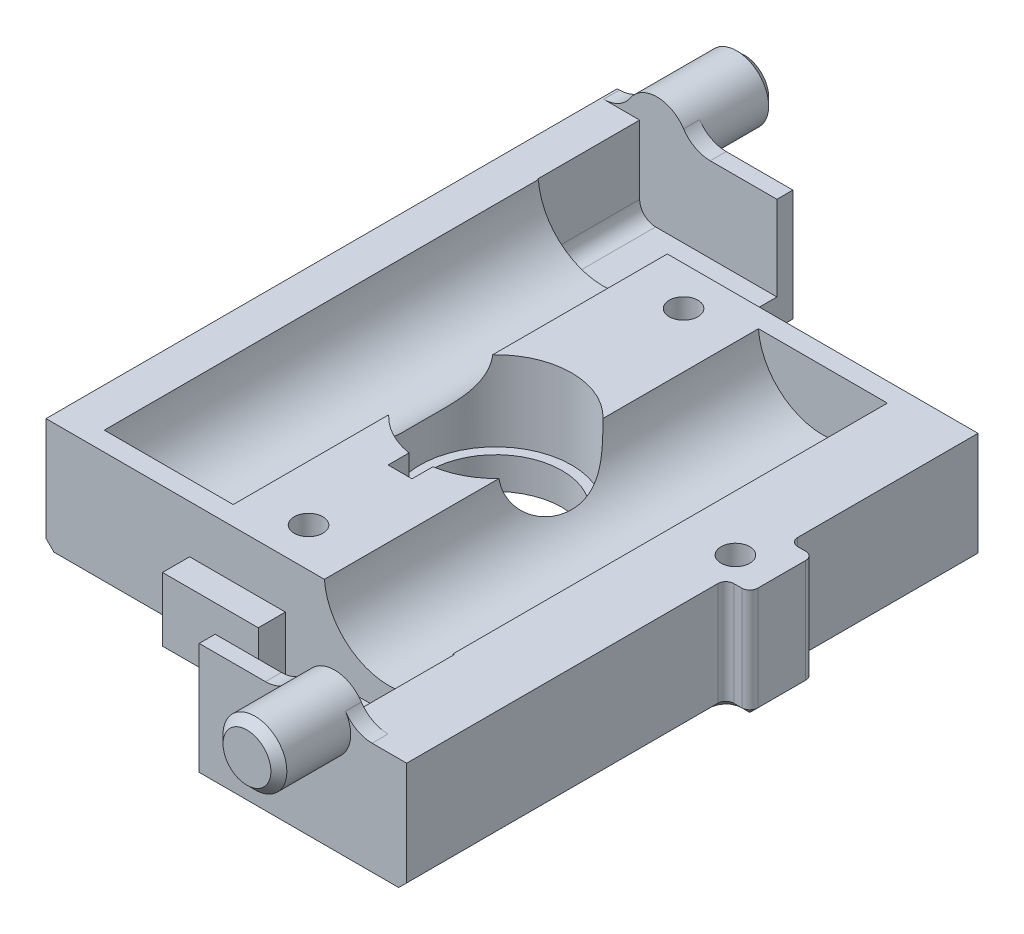
from build123d import *

# Parameters (mm, degrees)
SKETCH1_W            = 30
SKETCH1_H            = 30.8
BOSS_EXTRUDE1_DEPTH  = 7
SKETCH2_R            = 4.15
CUT_EXTRUDE1_DEPTH   = 6.5
SKETCH3_W            = 15
SKETCH3_H            = 1.2
SKETCH3_W_2          = 9
SKETCH3_W_3          = 11
SKETCH3_W_4          = 13
CUT_EXTRUDE2_DEPTH   = 4
SKETCH4_W            = 30
SKETCH4_H            = 3
CUT_EXTRUDE3_DEPTH   = 1.2
SKETCH5_W            = 30
SKETCH5_H            = 3
CUT_EXTRUDE4_DEPTH   = 1.2
SKETCH6_R            = 4.05
CUT_EXTRUDE5_DEPTH   = 27.2
SKETCH7_R            = 4.05
CUT_EXTRUDE6_DEPTH   = 27.2
SKETCH8_R            = 4.75
CUT_EXTRUDE7_DEPTH   = 5
BOSS_EXTRUDE2_DEPTH  = 6.4
FILLET1_R            = 1
BOSS_EXTRUDE3_DEPTH  = 6.4
FILLET2_R            = 1
SKETCH12_W           = 1.5
SKETCH12_H           = 1.344099237
CUT_EXTRUDE8_DEPTH   = 5
SKETCH13_W           = 13
SKETCH13_H           = 7
BOSS_EXTRUDE4_DEPTH  = 1
SKETCH14_W           = 11
SKETCH14_H           = 7
BOSS_EXTRUDE5_DEPTH  = 1
SKETCH15_R           = 2
BOSS_EXTRUDE8_DEPTH  = 5.5
SKETCH16_R           = 2
BOSS_EXTRUDE9_DEPTH  = 5.5
FILLET3_R            = 2
FILLET4_R            = 2
FILLET5_R            = 2
CHAMFER2_SIZE        = 0.5
CHAMFER3_SIZE        = 0.5
SKETCH17_W           = 4
SKETCH17_H           = 7
BOSS_EXTRUDE10_DEPTH = 1.5
FILLET7_R            = 0.5
SKETCH18_R           = 0.9
CUT_EXTRUDE9_DEPTH   = 99.965895754
SKETCH19_R           = 1.6
CUT_EXTRUDE10_DEPTH  = 2
SKETCH20_R           = 0.9
CUT_EXTRUDE11_DEPTH  = 99.965895754
SKETCH21_R           = 1.6
CUT_EXTRUDE12_DEPTH  = 2
CHAMFER6_SIZE        = 0.5
SKETCH22_W           = 6
SKETCH22_H           = 4
BOSS_EXTRUDE11_DEPTH = 0.5
SKETCH23_W           = 6
SKETCH23_H           = 4
BOSS_EXTRUDE12_DEPTH = 0.5


with BuildPart() as part:
    # Sketch1 → Boss-Extrude1 (new body)
    with BuildSketch(Plane(origin=(0, 0, 0), x_dir=(1, 0, 0), z_dir=(0, 1, 0))):
        with Locations((-46.45686042, -50.970505576)):
            Rectangle(SKETCH1_W, SKETCH1_H)
    extrude(amount=BOSS_EXTRUDE1_DEPTH)

    # Sketch2 → Cut-Extrude1 (cut)
    with BuildSketch(Plane.XZ):
        with Locations(Location((-47.47186042, 50.970505576, 0), (0, 0, 270))):
            Circle(SKETCH2_R)
    extrude(amount=-CUT_EXTRUDE1_DEPTH, mode=Mode.SUBTRACT)

    # Sketch3 → Cut-Extrude2 (cut)
    with BuildSketch(Plane.XZ):
        with Locations((-38.95686042, 65.770505576)):
            Rectangle(SKETCH3_W, SKETCH3_H)
        with Locations((-56.95686042, 65.770505576)):
            Rectangle(SKETCH3_W_2, SKETCH3_H)
        with Locations((-36.95686042, 36.170505576)):
            Rectangle(SKETCH3_W_3, SKETCH3_H)
        with Locations((-54.95686042, 36.170505576)):
            Rectangle(SKETCH3_W_4, SKETCH3_H)
    extrude(amount=-CUT_EXTRUDE2_DEPTH, mode=Mode.SUBTRACT)

    # Sketch4 → Cut-Extrude3 (cut)
    with BuildSketch(Plane.XY.offset(66.370505576)):
        with Locations((-46.45686042, 5.5)):
            Rectangle(SKETCH4_W, SKETCH4_H)
    extrude(amount=-CUT_EXTRUDE3_DEPTH, mode=Mode.SUBTRACT)

    # Sketch5 → Cut-Extrude4 (cut)
    with BuildSketch(Plane(origin=(0, 0, 35.570505576), x_dir=(-1, 0, 0), z_dir=(0, 0, -1))):
        with Locations((46.45686042, 5.5)):
            Rectangle(SKETCH5_W, SKETCH5_H)
    extrude(amount=-CUT_EXTRUDE4_DEPTH, mode=Mode.SUBTRACT)

    # Sketch6 → Cut-Extrude5 (cut)
    with BuildSketch(Plane.XY.offset(65.170505576)):
        with Locations((-39.974556342, 7.3)):
            Circle(SKETCH6_R)
    extrude(amount=-CUT_EXTRUDE5_DEPTH, mode=Mode.SUBTRACT)

    # Sketch7 → Cut-Extrude6 (cut)
    with BuildSketch(Plane(origin=(0, 0, 36.770505576), x_dir=(-1, 0, 0), z_dir=(0, 0, -1))):
        with Locations((54.96455223, 7.3)):
            Circle(SKETCH7_R)
    extrude(amount=-CUT_EXTRUDE6_DEPTH, mode=Mode.SUBTRACT)

    # Sketch8 → Cut-Extrude7 (cut)
    with BuildSketch(Plane(origin=(0, 7, 0), x_dir=(1, 0, 0), z_dir=(0, 1, 0))):
        with Locations(Location((-47.47186042, -50.970505576, 0), (0, 0, 270))):
            Circle(SKETCH8_R)
    extrude(amount=-CUT_EXTRUDE7_DEPTH, mode=Mode.SUBTRACT)

    # Sketch10 → Boss-Extrude2 (add)
    with BuildSketch(Plane.XY.offset(65.170505576)):
        Polygon((-31.45686042, 0), (-31.45686042, 7), (-35.85686042, 7), (-35.85686042, 1.7), (-44.45686042, 1.7), (-44.45686042, 0), align=None)
    extrude(amount=BOSS_EXTRUDE2_DEPTH)

    # Fillet1
    fillet1_edges = [part.edges().sort_by_distance(p)[0] for p in [
        (-35.85686042, 1.7, 68.370505576),
    ]]
    fillet(fillet1_edges, radius=FILLET1_R)

    # Sketch11 → Boss-Extrude3 (add)
    with BuildSketch(Plane(origin=(0, 0, 36.770505576), x_dir=(-1, 0, 0), z_dir=(0, 0, -1))):
        Polygon((61.45686042, 7), (61.45686042, 0), (50.45686042, 0), (50.45686042, 1.7), (59.05686042, 1.7), (59.05686042, 7), align=None)
    extrude(amount=BOSS_EXTRUDE3_DEPTH)

    # Fillet2
    fillet2_edges = [part.edges().sort_by_distance(p)[0] for p in [
        (-59.05686042, 1.7, 33.570505576),
    ]]
    fillet(fillet2_edges, radius=FILLET2_R)

    # Sketch12 → Cut-Extrude8 (cut)
    with BuildSketch(Plane(origin=(0, 7, 0), x_dir=(1, 0, 0), z_dir=(0, 1, 0))):
        with Locations((-47.47186042, -56.298455958)):
            Rectangle(SKETCH12_W, SKETCH12_H)
    extrude(amount=-CUT_EXTRUDE8_DEPTH, mode=Mode.SUBTRACT)

    # Sketch13 → Boss-Extrude4 (add)
    with BuildSketch(Plane.XY.offset(71.570505576)):
        with Locations((-37.95686042, 3.5)):
            Rectangle(SKETCH13_W, SKETCH13_H)
    extrude(amount=BOSS_EXTRUDE4_DEPTH)

    # Sketch14 → Boss-Extrude5 (add)
    with BuildSketch(Plane(origin=(0, 0, 30.370505576), x_dir=(-1, 0, 0), z_dir=(0, 0, -1))):
        with Locations((55.95686042, 3.5)):
            Rectangle(SKETCH14_W, SKETCH14_H)
    extrude(amount=BOSS_EXTRUDE5_DEPTH)

    # Sketch15 → Boss-Extrude8 (add)
    with BuildSketch(Plane.XY.offset(71.570505576)):
        with Locations(Location((-36.96455223, 6.8, 0), (0, 0, 174.260829523))):
            Circle(SKETCH15_R)
    extrude(amount=BOSS_EXTRUDE8_DEPTH)

    # Sketch16 → Boss-Extrude9 (add)
    with BuildSketch(Plane(origin=(0, 0, 30.370505576), x_dir=(-1, 0, 0), z_dir=(0, 0, -1))):
        with Locations(Location((57.974556342, 6.8, 0), (0, 0, 174.260829523))):
            Circle(SKETCH16_R)
    extrude(amount=BOSS_EXTRUDE9_DEPTH)

    # Fillet3
    fillet3_edges = [part.edges().sort_by_distance(p)[0] for p in [
        (-59.964531217, 7, 29.870505576),
    ]]
    fillet(fillet3_edges, radius=FILLET3_R)

    # Fillet4
    # the kernel refuses this fillet: 2 mm, written as the material it adds along each edge
    with BuildSketch(Plane(origin=(-55.984581468, 7, 30.370505576), x_dir=(1.0, 6.770411692114482e-12, 0), z_dir=(0, 0, -1))) as fillet4_piece_1:
        with BuildLine():
            CenterArc((1.350683743, -2), FILLET4_R, 90, 56.632987031)
            ThreePointArc((-0.319645565, -0.9), (-0.105311329, -0.469360383), (0, 0))
            Line((0, 0), (1.350683743, 0))
        make_face()
    extrude(amount=1)

    # Fillet5
    # the kernel refuses this fillet: 2 mm, written as the material it adds along each edge
    with BuildSketch(Plane(origin=(-38.954527104, 7, 71.570505576), x_dir=(-1.0, 6.9854393361833605e-12, 0), z_dir=(0, 0, 1)), Plane(origin=(-34.974577356, 7, 72.570505576), x_dir=(1, 0, 0), z_dir=(0, 0, -1))) as fillet5_piece_1:
        with BuildLine():
            CenterArc((1.350683743, -2), FILLET5_R, 90, 56.632987031)
            ThreePointArc((-0.319645565, -0.9), (-0.105311329, -0.469360383), (0, 0))
            Line((0, 0), (1.350683743, 0))
        make_face()
    extrude(amount=1)

    # Chamfer2
    chamfer2_edges = [part.edges().sort_by_distance(p)[0] for p in [
        (-34.974577356, 6.6, 77.070505576),
    ]]
    chamfer(chamfer2_edges, length=CHAMFER2_SIZE)

    # Chamfer3
    chamfer3_edges = [part.edges().sort_by_distance(p)[0] for p in [
        (-59.964531217, 6.6, 24.870505576),
    ]]
    chamfer(chamfer3_edges, length=CHAMFER3_SIZE)

    # Sketch17 → Boss-Extrude10 (add)
    with BuildSketch(Plane(origin=(-31.45686042, 0, 0), x_dir=(0, 0, -1), z_dir=(1, 0, 0))):
        with Locations((-50.570505576, 3.5)):
            Rectangle(SKETCH17_W, SKETCH17_H)
    extrude(amount=BOSS_EXTRUDE10_DEPTH)

    # Fillet7
    fillet7_edges = [part.edges().sort_by_distance(p)[0] for p in [
        (-31.45686042, 3.5, 52.570505576),
        (-31.45686042, 3.5, 48.570505576),
        (-29.95686042, 3.5, 52.570505576),
        (-29.95686042, 3.5, 48.570505576),
    ]]
    fillet(fillet7_edges, radius=FILLET7_R)

    # Sketch18 → Cut-Extrude9 (cut, through all)
    with BuildSketch(Plane.XZ):
        with Locations(Location((-32.45686042, 50.970505576, 0), (0, 0, 270))):
            Circle(SKETCH18_R)
    extrude(amount=-CUT_EXTRUDE9_DEPTH, mode=Mode.SUBTRACT)

    # Sketch19 → Cut-Extrude10 (cut)
    with BuildSketch(Plane.XZ):
        with Locations(Location((-32.45686042, 50.970505576, 0), (0, 0, 270))):
            Circle(SKETCH19_R)
    extrude(amount=-CUT_EXTRUDE10_DEPTH, mode=Mode.SUBTRACT)

    # Sketch20 → Cut-Extrude11 (cut, through all)
    with BuildSketch(Plane.XZ):
        with Locations(Location((-47.45686042, 62.720505576, 0), (0, 0, 270))):
            Circle(SKETCH20_R)
        with Locations(Location((-47.45686042, 39.220505576, 0), (0, 0, 270))):
            Circle(SKETCH20_R)
    extrude(amount=-CUT_EXTRUDE11_DEPTH, mode=Mode.SUBTRACT)

    # Sketch21 → Cut-Extrude12 (cut)
    with BuildSketch(Plane.XZ):
        with Locations(Location((-47.45686042, 62.720505576, 0), (0, 0, 270))):
            Circle(SKETCH21_R)
        with Locations(Location((-47.45686042, 39.220505576, 0), (0, 0, 270))):
            Circle(SKETCH21_R)
    extrude(amount=-CUT_EXTRUDE12_DEPTH, mode=Mode.SUBTRACT)

    # Chamfer6
    # the kernel refuses this chamfer: 0.5 mm, written as the material it takes off along each edge
    with BuildSketch(Plane(origin=(-61.45686042, 0, 28.084664082), x_dir=(1, 0, 0), z_dir=(0, 0, 1))) as chamfer6_piece_1:
        Polygon((CHAMFER6_SIZE, 0), (0, CHAMFER6_SIZE), (0, 0), align=None)
    extrude(amount=38.371682988, mode=Mode.SUBTRACT)
    with BuildSketch(Plane(origin=(-31.45686042, 0, 53.070505576), x_dir=(-1, 0, 0), z_dir=(0, 0, 1))) as chamfer6_piece_2:
        Polygon((CHAMFER6_SIZE, 0), (0, -CHAMFER6_SIZE), (0, 0), align=None)
    extrude(amount=20.785841494, mode=Mode.SUBTRACT)
    with BuildSketch(Plane(origin=(-30.95686042, 0, 52.570505576), x_dir=(0, 0, -1), z_dir=(1, 0, 0))) as chamfer6_piece_3:
        Polygon((CHAMFER6_SIZE, 0), (0, CHAMFER6_SIZE), (0, 0), align=None)
    extrude(amount=0.5, mode=Mode.SUBTRACT)
    with BuildSketch(Plane(origin=(-29.95686042, 0, 49.070505576), x_dir=(-1, 0, 0), z_dir=(0, 0, 1))) as chamfer6_piece_4:
        Polygon((CHAMFER6_SIZE, 0), (0, -CHAMFER6_SIZE), (0, 0), align=None)
    extrude(amount=3, mode=Mode.SUBTRACT)
    with BuildSketch(Plane(origin=(-31.45686042, 0, 35.484664082), x_dir=(-1, 0, 0), z_dir=(0, 0, 1))) as chamfer6_piece_5:
        Polygon((CHAMFER6_SIZE, 0), (0, -CHAMFER6_SIZE), (0, 0), align=None)
    extrude(amount=12.585841494, mode=Mode.SUBTRACT)
    with BuildSketch(Plane(origin=(-30.95686042, 0, 48.570505576), x_dir=(0, 0, 1), z_dir=(1, 0, 0))) as chamfer6_piece_6:
        Polygon((CHAMFER6_SIZE, 0), (0, -CHAMFER6_SIZE), (0, 0), align=None)
    extrude(amount=0.5, mode=Mode.SUBTRACT)
    with BuildSketch(Plane(origin=(-30.95686042, 0, 53.070505576), x_dir=(-1, 0, 0), z_dir=(0, 0, 1))) as chamfer6_piece_7:
        Polygon((0.5 + CHAMFER6_SIZE, 0), (0.5, -CHAMFER6_SIZE), (0.5, 0), align=None)
    revolve(axis=Axis((-30.95686042, 0, 53.070505576), (0, -1, 0)), revolution_arc=90, mode=Mode.SUBTRACT)
    with BuildSketch(Plane(origin=(-30.95686042, 0, 48.070505576), x_dir=(-1, 0, 0), z_dir=(0, 0, -1))) as chamfer6_piece_8:
        Polygon((0.5 + CHAMFER6_SIZE, 0), (0.5, CHAMFER6_SIZE), (0.5, 0), align=None)
    revolve(axis=Axis((-30.95686042, 0, 48.070505576), (0, 1, 0)), revolution_arc=90, mode=Mode.SUBTRACT)
    with BuildSketch(Plane(origin=(-30.45686042, 0, 49.070505576), x_dir=(0, 0, -1), z_dir=(-1, 0, 0))) as chamfer6_piece_9:
        Polygon((0.5 - CHAMFER6_SIZE, 0), (0.5, -CHAMFER6_SIZE), (0.5, 0), align=None)
    revolve(axis=Axis((-30.45686042, 0, 49.070505576), (0, -1, 0)), revolution_arc=90, mode=Mode.SUBTRACT)
    with BuildSketch(Plane(origin=(-30.45686042, 0, 52.070505576), x_dir=(0, 0, 1), z_dir=(-1, 0, 0))) as chamfer6_piece_10:
        Polygon((0.5 - CHAMFER6_SIZE, 0), (0.5, CHAMFER6_SIZE), (0.5, 0), align=None)
    revolve(axis=Axis((-30.45686042, 0, 52.070505576), (0, 1, 0)), revolution_arc=90, mode=Mode.SUBTRACT)

    # Sketch22 → Boss-Extrude11 (add)
    with BuildSketch(Plane(origin=(0, 0, 35.570505576), x_dir=(-1, 0, 0), z_dir=(0, 0, -1))):
        with Locations((45.45686042, 2)):
            Rectangle(SKETCH22_W, SKETCH22_H)
    extrude(amount=BOSS_EXTRUDE11_DEPTH)

    # Sketch23 → Boss-Extrude12 (add)
    with BuildSketch(Plane.XY.offset(66.370505576)):
        with Locations((-49.45686042, 2)):
            Rectangle(SKETCH23_W, SKETCH23_H)
    extrude(amount=BOSS_EXTRUDE12_DEPTH)


solid = part.part
